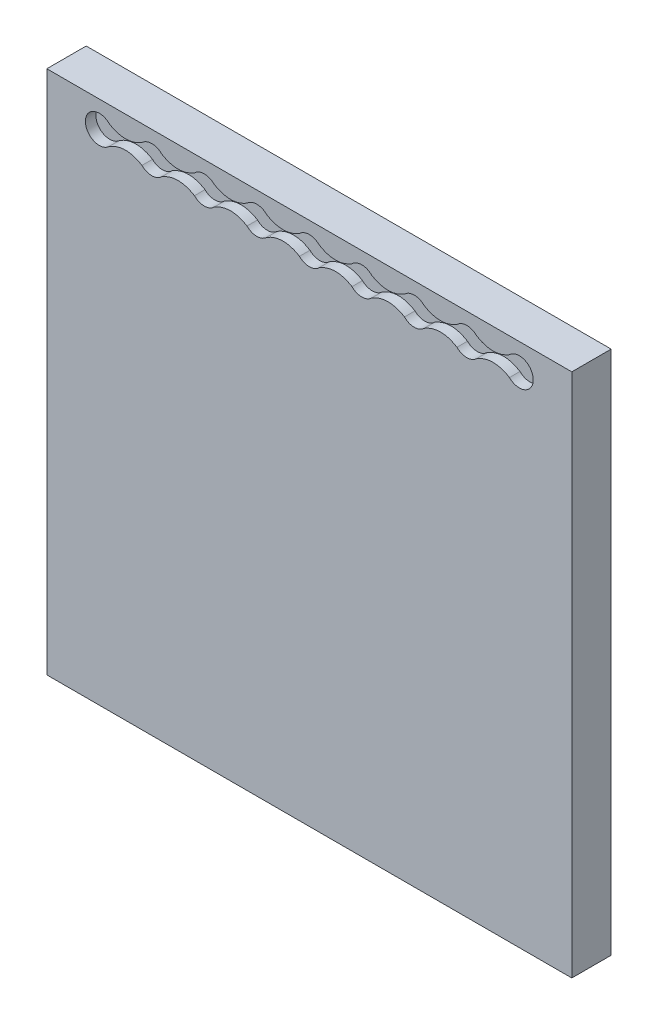
from build123d import *

# Parameters (mm, degrees)
SKETCH2_W           = 127
SKETCH2_H           = 127
BOSS_EXTRUDE1_DEPTH = 9.525
CUT_EXTRUDE1_DEPTH  = 2.54
LPATTERN1_COUNT     = 8
LPATTERN1_PITCH     = 12.7


with BuildPart() as part:
    # Sketch2 → Boss-Extrude1 (new body)
    with BuildSketch(Plane.XY):
        with Locations((32.439124974, 32.129034202)):
            Rectangle(SKETCH2_W, SKETCH2_H)
    extrude(amount=BOSS_EXTRUDE1_DEPTH)

    # Sketch1 → Cut-Extrude1 (cut)
    with BuildSketch(Plane.XY.offset(9.525)):
        with BuildLine():
            ThreePointArc((-15.975494494, 91.664414734), (-21.734312526, 89.279034202), (-15.975494494, 86.893653669))
            add(Edge.make_bspline(
                [(-15.975494494, 86.893653669), (-12.010875026, 89.283164734), (-8.046255558, 86.893653669)],
                knots=[0, 0, 0, 1, 1, 1], degree=2))
            ThreePointArc((-8.046255558, 86.893653669), (-2.287437526, 89.279034202), (-8.046255558, 91.664414734))
            add(Edge.make_bspline(
                [(-15.975494494, 91.664414734), (-12.010875026, 89.274903669), (-8.046255558, 91.664414734)],
                knots=[0, 0, 0, 1, 1, 1], degree=2))
        make_face()
    cut_extrude1 = extrude(amount=-CUT_EXTRUDE1_DEPTH, mode=Mode.SUBTRACT)

    # LPattern1: Cut-Extrude1 ×8
    with Locations(*[(i * LPATTERN1_PITCH, 0, 0) for i in range(1, LPATTERN1_COUNT)]):
        add(cut_extrude1, mode=Mode.SUBTRACT)


solid = part.part
